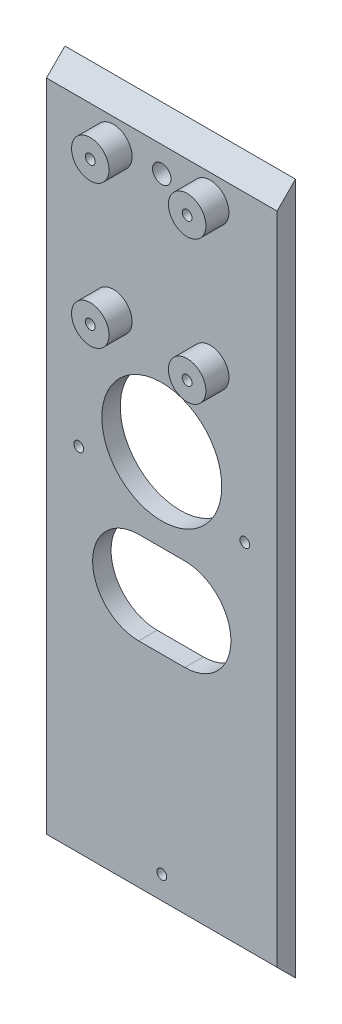
from build123d import *

# Parameters (mm, degrees)
SKETCH1_W           = 150
SKETCH1_H           = 50
BOSS_EXTRUDE1_DEPTH = 4
CHAMFER1_SIZE       = 4
SKETCH2_R           = 13
SKETCH2_R_2         = 1.065
SKETCH2_R_3         = 2
CUT_EXTRUDE2_DEPTH  = 4
SKETCH6_R           = 4.065
SKETCH6_R_2         = 1.065
BOSS_EXTRUDE2_DEPTH = 5


with BuildPart() as part:
    # Sketch1 → Boss-Extrude1 (new body)
    with BuildSketch(Plane(origin=(0, 0, 0), x_dir=(0, 1, 0), z_dir=(0, 0, 1))):
        with Locations((75, 25)):
            Rectangle(SKETCH1_W, SKETCH1_H)
    extrude(amount=BOSS_EXTRUDE1_DEPTH)

    # Chamfer1
    chamfer1_edges = [part.edges().sort_by_distance(p)[0] for p in [
        (-25, 150, 4),
        (-25, 0, 4),
    ]]
    chamfer(chamfer1_edges, length=CHAMFER1_SIZE - 0.0001)  # a hair under: the kernel refuses the full size

    # Sketch2 → Cut-Extrude2 (cut)
    with BuildSketch(Plane.XY.offset(4)):
        with Locations((-25, 88.3)):
            Circle(SKETCH2_R)
        with Locations((-25, 9)):
            Circle(SKETCH2_R_2)
        with Locations((-7, 80.3)):
            Circle(SKETCH2_R_2)
        with Locations((-43, 80.3)):
            Circle(SKETCH2_R_2)
        with Locations((-25, 140.5)):
            Circle(SKETCH2_R_3)
        with BuildLine():
            Line((-30, 70.3), (-20, 70.3))
            ThreePointArc((-20, 70.3), (-10, 60.3), (-20, 50.3))
            Line((-20, 50.3), (-30, 50.3))
            ThreePointArc((-30, 50.3), (-40, 60.3), (-30, 70.3))
        make_face()
    extrude(amount=-CUT_EXTRUDE2_DEPTH, mode=Mode.SUBTRACT)

    # Sketch6 → Boss-Extrude2 (add)
    # profile 1 of 4: a face of its own
    with BuildSketch(Plane.XY.offset(4)):
        with Locations(Location((-35.5, 140.5, 0), (0, 0, 180))):
            Circle(SKETCH6_R)
        with Locations((-35.5, 140.5)):
            Circle(SKETCH6_R_2, mode=Mode.SUBTRACT)
    # profile 2 of 4: a face of its own
    with BuildSketch(Plane.XY.offset(4)):
        with Locations(Location((-14.5, 140.5, 0), (0, 0, 180))):
            Circle(SKETCH6_R)
        with Locations((-14.5, 140.5)):
            Circle(SKETCH6_R_2, mode=Mode.SUBTRACT)
    # profile 3 of 4: a face of its own
    with BuildSketch(Plane.XY.offset(4)):
        with Locations(Location((-14.5, 109.5, 0), (0, 0, 180))):
            Circle(SKETCH6_R)
        with Locations((-14.5, 109.5)):
            Circle(SKETCH6_R_2, mode=Mode.SUBTRACT)
    # profile 4 of 4: a face of its own
    with BuildSketch(Plane.XY.offset(4)):
        with Locations(Location((-35.5, 109.5, 0), (0, 0, 180))):
            Circle(SKETCH6_R)
        with Locations((-35.5, 109.5)):
            Circle(SKETCH6_R_2, mode=Mode.SUBTRACT)
    extrude(amount=BOSS_EXTRUDE2_DEPTH)


solid = part.part
